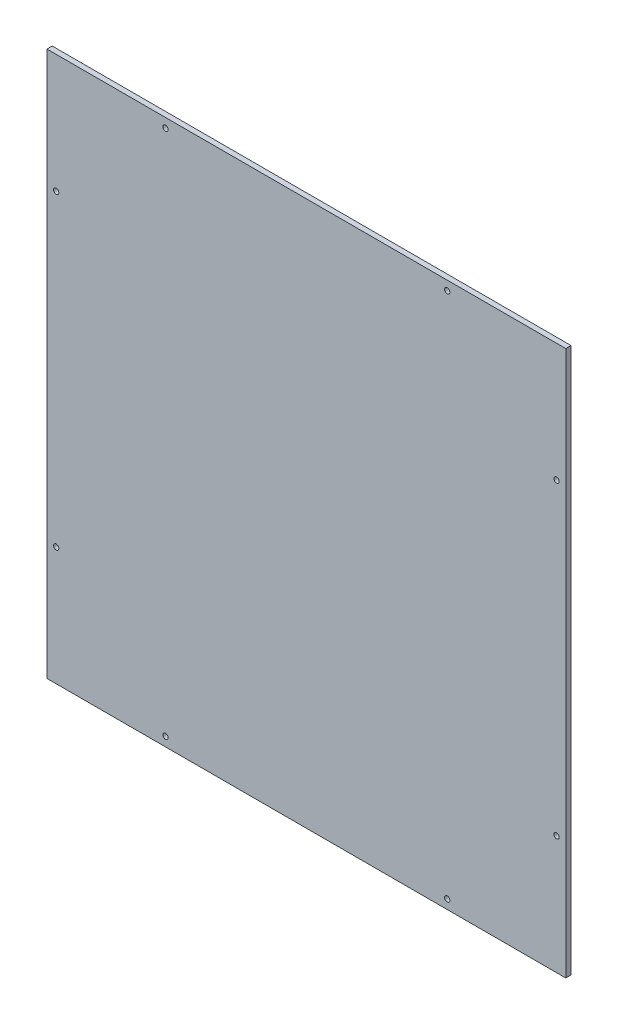
from build123d import *

# Parameters (mm, degrees)
SCHIZZO1_W                   = 394
SCHIZZO1_H                   = 414
SCHIZZO1_R                   = 2
ESTRUSIONE_ESTRUSIONE1_DEPTH = 4


with BuildPart() as part:
    # Schizzo1 → Estrusione-Estrusione1 (new body)
    with BuildSketch(Plane.XY):
        with Locations((-197, 207)):
            Rectangle(SCHIZZO1_W, SCHIZZO1_H)
        with Locations((-90, 407)):
            Circle(SCHIZZO1_R, mode=Mode.SUBTRACT)
        with Locations((-7, 324)):
            Circle(SCHIZZO1_R, mode=Mode.SUBTRACT)
        with Locations((-304, 407)):
            Circle(SCHIZZO1_R, mode=Mode.SUBTRACT)
        with Locations((-387, 324)):
            Circle(SCHIZZO1_R, mode=Mode.SUBTRACT)
        with Locations((-304, 7)):
            Circle(SCHIZZO1_R, mode=Mode.SUBTRACT)
        with Locations((-387, 90)):
            Circle(SCHIZZO1_R, mode=Mode.SUBTRACT)
        with Locations((-7, 90)):
            Circle(SCHIZZO1_R, mode=Mode.SUBTRACT)
        with Locations((-90, 7)):
            Circle(SCHIZZO1_R, mode=Mode.SUBTRACT)
    extrude(amount=ESTRUSIONE_ESTRUSIONE1_DEPTH)


solid = part.part
